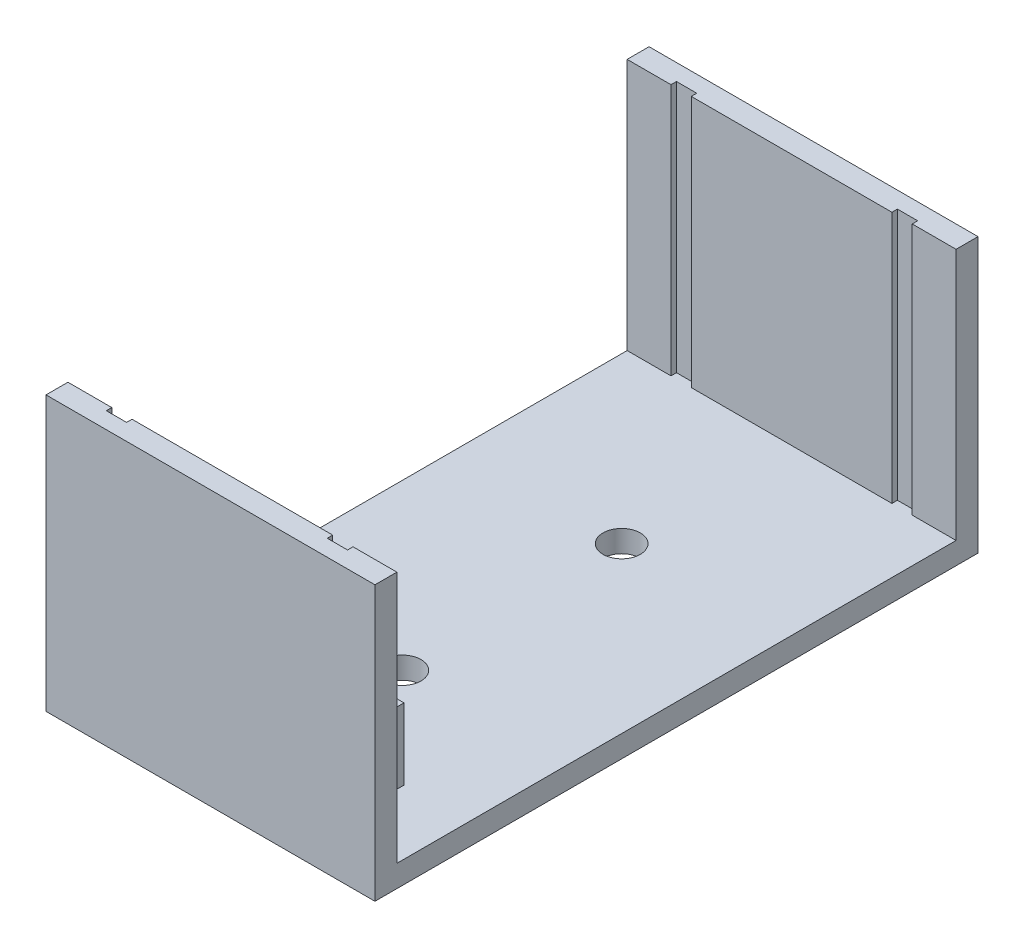
from build123d import *

# Parameters (mm, degrees)
BOSS_EXTRUDE1_DEPTH   = 25
BOSS_EXTRUDE1_2_DEPTH = 25
BOSS_EXTRUDE2_DEPTH   = 2
SKETCH2_W             = 18.3
SKETCH2_H             = 6.5
BOSS_EXTRUDE3_DEPTH   = 6.5
CUT_EXTRUDE1_REACH    = 46.322
SKETCH3_R             = 1.45
CUT_EXTRUDE3_REACH    = 40.862
SKETCH4_R             = 1.7


with BuildPart() as part:
    # Sketch1 → Boss-Extrude1 (new body)
    with BuildSketch(Plane(origin=(0, 0, 0), x_dir=(1, 0, 0), z_dir=(0, 1, 0))):
        Polygon((15, 27.5), (-15, 27.5), (-15, 25.5), (-11, 25.5), (-11, 26), (-9.15, 26), (-9.15, 25.5), (9.15, 25.5), (9.15, 26), (11, 26), (11, 25.5), (15, 25.5), align=None)
    extrude(amount=BOSS_EXTRUDE1_DEPTH)



with BuildPart() as body_2:
    # Sketch1 → Boss-Extrude1 2 (new body)
    with BuildSketch(Plane(origin=(0, 0, 0), x_dir=(1, 0, 0), z_dir=(0, 1, 0))):
        Polygon((-11, -25.5), (-15, -25.5), (-15, -27.5), (15, -27.5), (15, -25.5), (11, -25.5), (11, -26), (9.15, -26), (9.15, -25.5), (-9.15, -25.5), (-9.15, -26), (-11, -26), align=None)
    extrude(amount=BOSS_EXTRUDE1_2_DEPTH)


with BuildPart() as part_1:
    add(part.part)

    add(body_2.part)  # Boss-Extrude2 merges body 2
    # Sketch1<3> → Boss-Extrude2 (add)
    with BuildSketch(Plane(origin=(0, 0, 0), x_dir=(1, 0, 0), z_dir=(0, 1, 0))):
        Polygon((-11, 25.5), (-15, 25.5), (-15, -25.5), (-11, -25.5), (-11, -26), (-9.15, -26), (-9.15, -25.5), (9.15, -25.5), (9.15, -26), (11, -26), (11, -25.5), (15, -25.5), (15, 25.5), (11, 25.5), (11, 26), (9.15, 26), (9.15, 25.5), (-9.15, 25.5), (-9.15, 26), (-11, 26), align=None)
    extrude(amount=BOSS_EXTRUDE2_DEPTH)

    # Sketch2 → Boss-Extrude3 (add)
    with BuildSketch(Plane(origin=(0, 2, 0), x_dir=(1, 0, 0), z_dir=(0, 1, 0))):
        with Locations((0, -22.25)):
            Rectangle(SKETCH2_W, SKETCH2_H)
    extrude(amount=BOSS_EXTRUDE3_DEPTH)

    # Sketch3 → Cut-Extrude1 (cut, up to next)
    with BuildSketch(Plane(origin=(9.15, 0, 0), x_dir=(0, 0, -1), z_dir=(1, 0, 0)), mode=Mode.PRIVATE) as cut_extrude1_sk1:
        with Locations((-21.7, 5.8)):
            Circle(SKETCH3_R)
    cut_extrude1_tool1 = extrude(cut_extrude1_sk1.sketch, amount=-CUT_EXTRUDE1_REACH, mode=Mode.PRIVATE) & part_1.part
    add(cut_extrude1_tool1.solids().sort_by_distance((9.15, 5.8, 21.7))[0], mode=Mode.SUBTRACT)

    # Sketch4 → Cut-Extrude3 (cut, up to next)
    with BuildSketch(Plane(origin=(0, 2, 0), x_dir=(1, 0, 0), z_dir=(0, 1, 0)), mode=Mode.PRIVATE) as cut_extrude3_sk1:
        with Locations((0, 10)):
            Circle(SKETCH4_R)
    cut_extrude3_tool1 = extrude(cut_extrude3_sk1.sketch, amount=-CUT_EXTRUDE3_REACH, mode=Mode.PRIVATE) & part_1.part
    # Sketch4 → Cut-Extrude3 (cut, up to next)
    with BuildSketch(Plane(origin=(0, 2, 0), x_dir=(1, 0, 0), z_dir=(0, 1, 0)), mode=Mode.PRIVATE) as cut_extrude3_sk2:
        with Locations((0, -10)):
            Circle(SKETCH4_R)
    cut_extrude3_tool2 = extrude(cut_extrude3_sk2.sketch, amount=-CUT_EXTRUDE3_REACH, mode=Mode.PRIVATE) & part_1.part
    add(cut_extrude3_tool1.solids().sort_by_distance((0, 2, -10))[0], mode=Mode.SUBTRACT)
    add(cut_extrude3_tool2.solids().sort_by_distance((0, 2, 10))[0], mode=Mode.SUBTRACT)


solid = part_1.part
